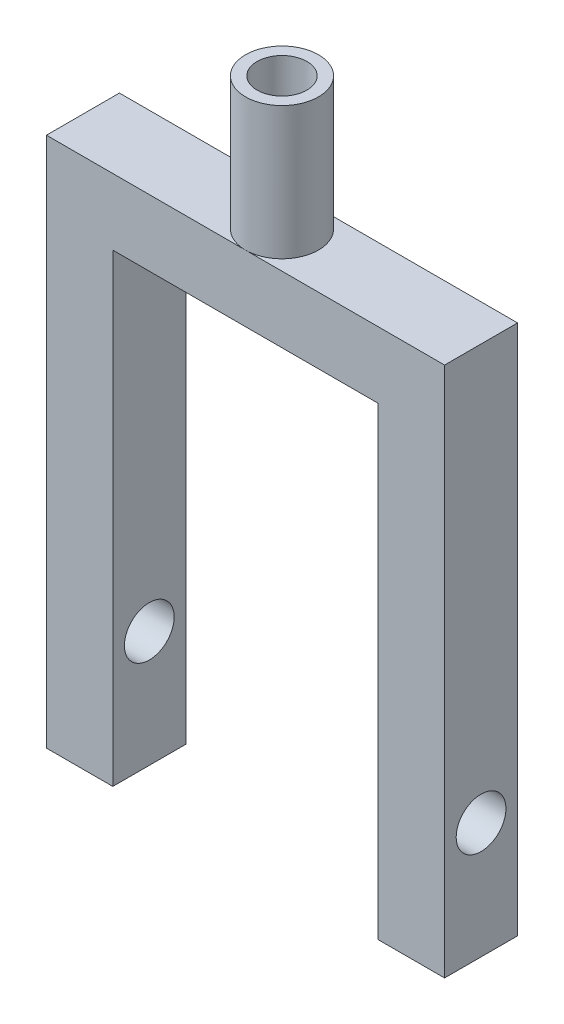
from build123d import *

# Parameters (mm, degrees)
SKETCH1_R               = 6.985
BOSS_EXTRUDE1_DEPTH     = 25.4
SKETCH3_R               = 4.7625
CUT_EXTRUDE1_DEPTH      = 63.5
SKETCH5_W               = 76.2
SKETCH5_H               = 13.97
BOSS_EXTRUDE2_DEPTH     = 101.6
SKETCH6_W               = 50.8
SKETCH6_H               = 88.9
CUT_EXTRUDE2_DEPTH      = 134.325807329
SKETCH7_R               = 4.7625
CUT_EXTRUDE3_DEPTH      = 133.775751645
CUT_EXTRUDE4_DEPTH      = 143.162021036
CUT_EXTRUDE4_DEPTH_BACK = 19.05
SKETCH8_R               = 4.7625


with BuildPart() as part:
    # Sketch1 → Boss-Extrude1 (new body)
    with BuildSketch(Plane(origin=(0, 0, 0), x_dir=(1, 0, 0), z_dir=(0, 1, 0))):
        Circle(SKETCH1_R)
    extrude(amount=-BOSS_EXTRUDE1_DEPTH)

    # Sketch3 → Cut-Extrude1 (cut)
    with BuildSketch(Plane(origin=(0, 0, 0), x_dir=(1, 0, 0), z_dir=(0, 1, 0))):
        Circle(SKETCH3_R)
    extrude(amount=-CUT_EXTRUDE1_DEPTH, mode=Mode.SUBTRACT)

    # Sketch5 → Boss-Extrude2 (add)
    with BuildSketch(Plane(origin=(0, -25.4, 0), x_dir=(-1, 0, 0), z_dir=(0, -1, 0))):
        Rectangle(SKETCH5_W, SKETCH5_H)
    extrude(amount=BOSS_EXTRUDE2_DEPTH)

    # Sketch6 → Cut-Extrude2 (cut, through all)
    with BuildSketch(Plane(origin=(0, 0, -6.985), x_dir=(-1, 0, 0), z_dir=(0, 0, -1))):
        with Locations((0, -82.55)):
            Rectangle(SKETCH6_W, SKETCH6_H)
    extrude(amount=-CUT_EXTRUDE2_DEPTH, mode=Mode.SUBTRACT)

    # Sketch7 → Cut-Extrude3 (cut, through all)
    with BuildSketch(Plane(origin=(0, 0, 0), x_dir=(1, 0, 0), z_dir=(0, 1, 0))):
        Circle(SKETCH7_R)
    extrude(amount=-CUT_EXTRUDE3_DEPTH, mode=Mode.SUBTRACT)

    # Sketch8 → Cut-Extrude4 (cut, two sides: drawn at the far end of the back side and taken through both)
    with BuildSketch(Plane.ZY.offset(-25.4).offset(-CUT_EXTRUDE4_DEPTH_BACK)):
        with Locations((0, -104.775)):
            Circle(SKETCH8_R)
    extrude(amount=CUT_EXTRUDE4_DEPTH + CUT_EXTRUDE4_DEPTH_BACK, mode=Mode.SUBTRACT)


solid = part.part
